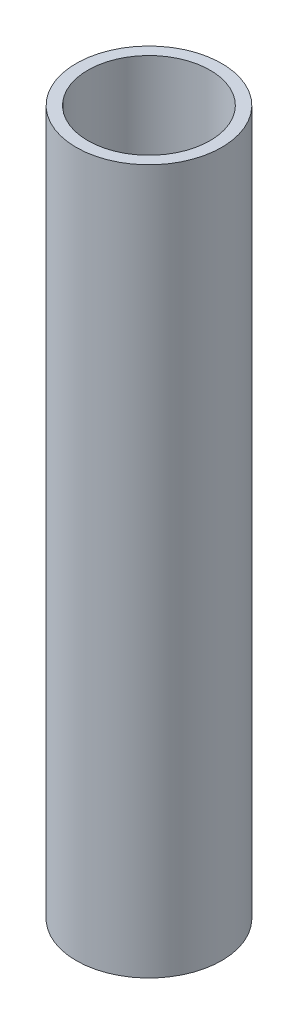
from build123d import *

# Parameters (mm, degrees)
SKETCH1_R           = 12.5
SKETCH1_R_2         = 10.5
BOSS_EXTRUDE1_DEPTH = 121


with BuildPart() as part:
    # Sketch1 → Boss-Extrude1 (new body)
    with BuildSketch(Plane(origin=(0, 0, 0), x_dir=(1, 0, 0), z_dir=(0, 1, 0))):
        Circle(SKETCH1_R)
        Circle(SKETCH1_R_2, mode=Mode.SUBTRACT)
    extrude(amount=BOSS_EXTRUDE1_DEPTH)


solid = part.part
